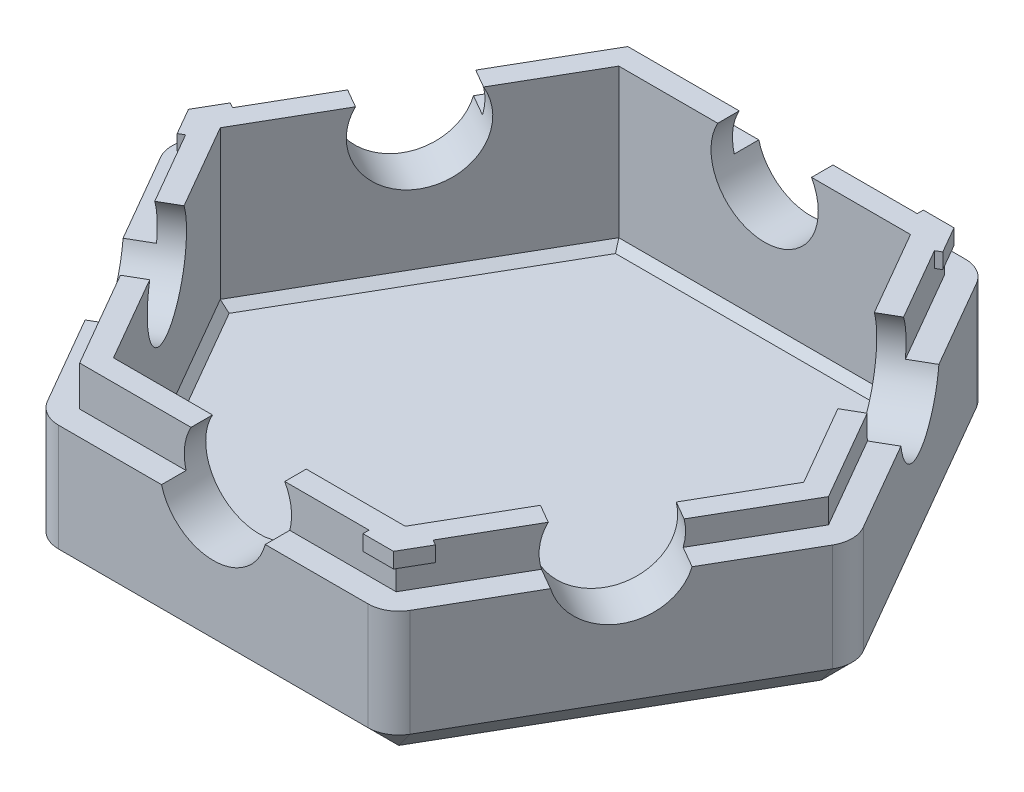
from build123d import *

# Parameters (mm, degrees)
BOSS_EXTRUDE1_START = -3.7
BOSS_EXTRUDE1_DEPTH = 10
CUT_EXTRUDE1_DEPTH  = 8.6
BOSS_EXTRUDE2_DEPTH = 1.6
FILLET1_R           = 2
CUT_EXTRUDE4_START  = -1
CUT_EXTRUDE4_DEPTH  = 1
CUT_EXTRUDE3_REACH  = 48.892
SKETCH4_R           = 3.5
CIRPATTERN1_COUNT   = 6
CHAMFER1_SIZE       = 0.5
CHAMFER2_SIZE       = 2
BOSS_EXTRUDE3_DEPTH = 1
CUT_EXTRUDE5_DEPTH  = 1


with BuildPart() as part:
    # Sketch1 → Boss-Extrude1 (new body)
    with BuildSketch(Plane(origin=(0, 0, 0), x_dir=(1, 0, 0), z_dir=(0, 1, 0)).offset(BOSS_EXTRUDE1_START)):
        Polygon((22.5, 0), (11.25, 19.485571585), (-11.25, 19.485571585), (-22.5, 0), (-11.25, -19.485571585), (11.25, -19.485571585), align=None)
    extrude(amount=-BOSS_EXTRUDE1_DEPTH)

    # Sketch2 → Cut-Extrude1 (cut)
    with BuildSketch(Plane(origin=(0, -3.7, 0), x_dir=(1, 0, 0), z_dir=(0, 1, 0))):
        Polygon((9.517949192, -16.485571585), (19.035898385, 0), (9.517949192, 16.485571585), (-9.517949192, 16.485571585), (-19.035898385, 0), (-9.517949192, -16.485571585), align=None)
    extrude(amount=-CUT_EXTRUDE1_DEPTH, mode=Mode.SUBTRACT)

    # Sketch3 → Boss-Extrude2 (add)
    with BuildSketch(Plane(origin=(0, -3.7, 0), x_dir=(1, 0, 0), z_dir=(0, 1, 0))):
        Polygon((10.326239569, -17.885571585), (20.652479139, 0), (10.326239569, 17.885571585), (-10.326239569, 17.885571585), (-20.652479139, 0), (-10.326239569, -17.885571585), align=None)
        Polygon((-9.517949192, -16.485571585), (9.517949192, -16.485571585), (19.035898385, 0), (9.517949192, 16.485571585), (-9.517949192, 16.485571585), (-19.035898385, 0), align=None, mode=Mode.SUBTRACT)
    extrude(amount=BOSS_EXTRUDE2_DEPTH)

    # Fillet1
    fillet1_edges = [part.edges().sort_by_distance(p)[0] for p in [
        (22.5, -8.7, 0),
        (11.25, -8.7, 19.485571585),
        (-11.25, -8.7, 19.485571585),
        (-22.5, -8.7, 0),
        (-11.25, -8.7, -19.485571585),
        (11.25, -8.7, -19.485571585),
    ]]
    fillet(fillet1_edges, radius=FILLET1_R)

    # Sketch6 → Cut-Extrude4 (cut)
    with BuildSketch(Plane(origin=(0, -3.7, 0), x_dir=(1, 0, 0), z_dir=(0, 1, 0)).offset(CUT_EXTRUDE4_START)):
        with BuildLine():
            Line((11.827350269, -18.485571585), (21.922649731, -1))
            ThreePointArc((21.922649731, -1), (22.190598923, 0), (21.922649731, 1))
            Line((21.922649731, 1), (11.827350269, 18.485571585))
            ThreePointArc((11.827350269, 18.485571585), (11.095299462, 19.217622393), (10.095299462, 19.485571585))
            Line((10.095299462, 19.485571585), (-10.095299462, 19.485571585))
            ThreePointArc((-10.095299462, 19.485571585), (-11.095299462, 19.217622393), (-11.827350269, 18.485571585))
            Line((-11.827350269, 18.485571585), (-21.922649731, 1))
            ThreePointArc((-21.922649731, 1), (-22.190598923, 0), (-21.922649731, -1))
            Line((-21.922649731, -1), (-11.827350269, -18.485571585))
            ThreePointArc((-11.827350269, -18.485571585), (-11.095299462, -19.217622393), (-10.095299462, -19.485571585))
            Line((-10.095299462, -19.485571585), (10.095299462, -19.485571585))
            ThreePointArc((10.095299462, -19.485571585), (11.095299462, -19.217622393), (11.827350269, -18.485571585))
        make_face()
        Polygon((10.326239569, -17.885571585), (20.652479139, 0), (10.326239569, 17.885571585), (-10.326239569, 17.885571585), (-20.652479139, 0), (-10.326239569, -17.885571585), align=None, mode=Mode.SUBTRACT)
    extrude(amount=CUT_EXTRUDE4_DEPTH, mode=Mode.SUBTRACT)

    # Sketch4 → Cut-Extrude3 (cut, up to next)
    with BuildSketch(Plane(origin=(0, 0, -19.485571585), x_dir=(-1, 0, 0), z_dir=(0, 0, -1)), mode=Mode.PRIVATE) as cut_extrude3_sk1:
        with Locations((0, -3.8)):
            Circle(SKETCH4_R)
    cut_extrude3_tool1 = extrude(cut_extrude3_sk1.sketch, amount=-CUT_EXTRUDE3_REACH, mode=Mode.PRIVATE) & part.part
    cut_extrude3 = cut_extrude3_tool1.solids().sort_by_distance((0, -3.8, -19.485572))[0]
    add(cut_extrude3, mode=Mode.SUBTRACT)

    # CirPattern1: Cut-Extrude3 ×6 about axis
    cirpattern1_axis = Axis((0, -14.28, 0), (0, 1, 0))
    for i in range(1, CIRPATTERN1_COUNT):
        add(cut_extrude3.rotate(cirpattern1_axis, i * 360 / CIRPATTERN1_COUNT), mode=Mode.SUBTRACT)

    # Chamfer1
    chamfer1_edges = [part.edges().sort_by_distance(p)[0] for p in [
        (-14.276923789, -12.3, 8.242785793),
        (-14.276923789, -12.3, -8.242785793),
        (0, -12.3, -16.485571585),
        (14.276923789, -12.3, -8.242785793),
        (14.276923789, -12.3, 8.242785793),
        (0, -12.3, 16.485571585),
    ]]
    chamfer(chamfer1_edges, length=CHAMFER1_SIZE)

    # Chamfer2
    chamfer2_edges = [part.edges().sort_by_distance(p)[0] for p in [
        (0, -13.7, 19.485571585),
        (11.095299462, -13.7, 19.217622393),
        (-11.095299462, -13.7, 19.217622393),
        (16.875, -13.7, 9.742785793),
        (-16.875, -13.7, 9.742785793),
        (22.190598923, -13.7, 0),
        (-22.190598923, -13.7, 0),
        (16.875, -13.7, -9.742785793),
        (-16.875, -13.7, -9.742785793),
        (11.095299462, -13.7, -19.217622393),
        (-11.095299462, -13.7, -19.217622393),
        (0, -13.7, -19.485571585),
    ]]
    chamfer(chamfer2_edges, length=CHAMFER2_SIZE)

    # Sketch7 → Boss-Extrude3 (add)
    with BuildSketch(Plane(origin=(0, -2.1, 0), x_dir=(1, 0, 0), z_dir=(0, 1, 0))):
        Polygon((8.557179677, 17.885571585), (8.557179677, 18.285571585), (10.557179677, 18.285571585), (11.557179677, 16.553520778), (11.210769515, 16.353520778), (10.326239569, 17.885571585), align=None)
        Polygon((8.557179677, -18.285571585), (10.557179677, -18.285571585), (11.557179677, -16.553520778), (11.210769515, -16.353520778), (10.326239569, -17.885571585), (8.557179677, -17.885571585), align=None)
        Polygon((-20.114359354, 1.732050808), (-21.114359354, 0), (-20.114359354, -1.732050808), (-19.767949192, -1.532050808), (-20.652479139, 0), (-19.767949192, 1.532050808), align=None)
    extrude(amount=-BOSS_EXTRUDE3_DEPTH)

    # Sketch9 → Cut-Extrude5 (cut)
    with BuildSketch(Plane(origin=(0, -2.1, 0), x_dir=(1, 0, 0), z_dir=(0, 1, 0))):
        Polygon((17.019065208, 6.293257533), (15.806629643, 5.593257533), (19.035898385, 0), (15.806629643, -5.593257533), (17.019065208, -6.293257533), (20.652479139, 0), align=None)
    extrude(amount=-CUT_EXTRUDE5_DEPTH, mode=Mode.SUBTRACT)


solid = part.part
